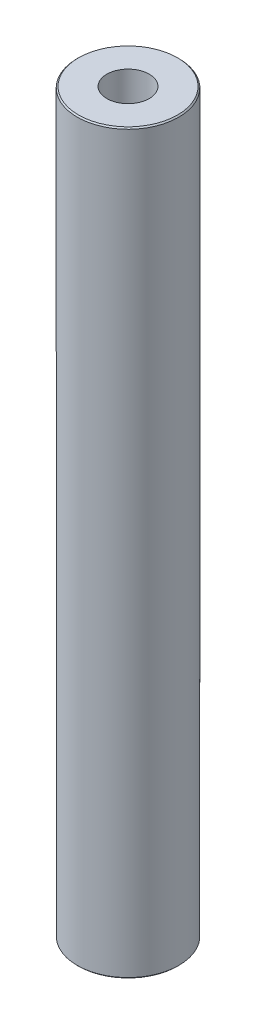
from build123d import *

# Parameters (mm, degrees)
SKETCH1_R           = 32.5
BOSS_EXTRUDE1_DEPTH = 471.694288006
SKETCH2_R           = 13.562604416
CUT_EXTRUDE1_DEPTH  = 474.928266025
CHAMFER1_SIZE       = 0.801250431


with BuildPart() as part:
    # Sketch1 → Boss-Extrude1 (new body)
    with BuildSketch(Plane(origin=(0, 0, 0), x_dir=(1, 0, 0), z_dir=(0, 1, 0))):
        Circle(SKETCH1_R)
    extrude(amount=BOSS_EXTRUDE1_DEPTH)

    # Sketch2 → Cut-Extrude1 (cut, through all)
    with BuildSketch(Plane(origin=(0, 0, 0), x_dir=(1, 0, 0), z_dir=(0, 1, 0))):
        Circle(SKETCH2_R)
    extrude(amount=CUT_EXTRUDE1_DEPTH, mode=Mode.SUBTRACT)

    # Chamfer1
    chamfer1_edges = [part.edges().sort_by_distance(p)[0] for p in [
        (-32.5, 471.694288006, 0),
        (-32.5, 0, 0),
    ]]
    chamfer(chamfer1_edges, length=CHAMFER1_SIZE)


solid = part.part
